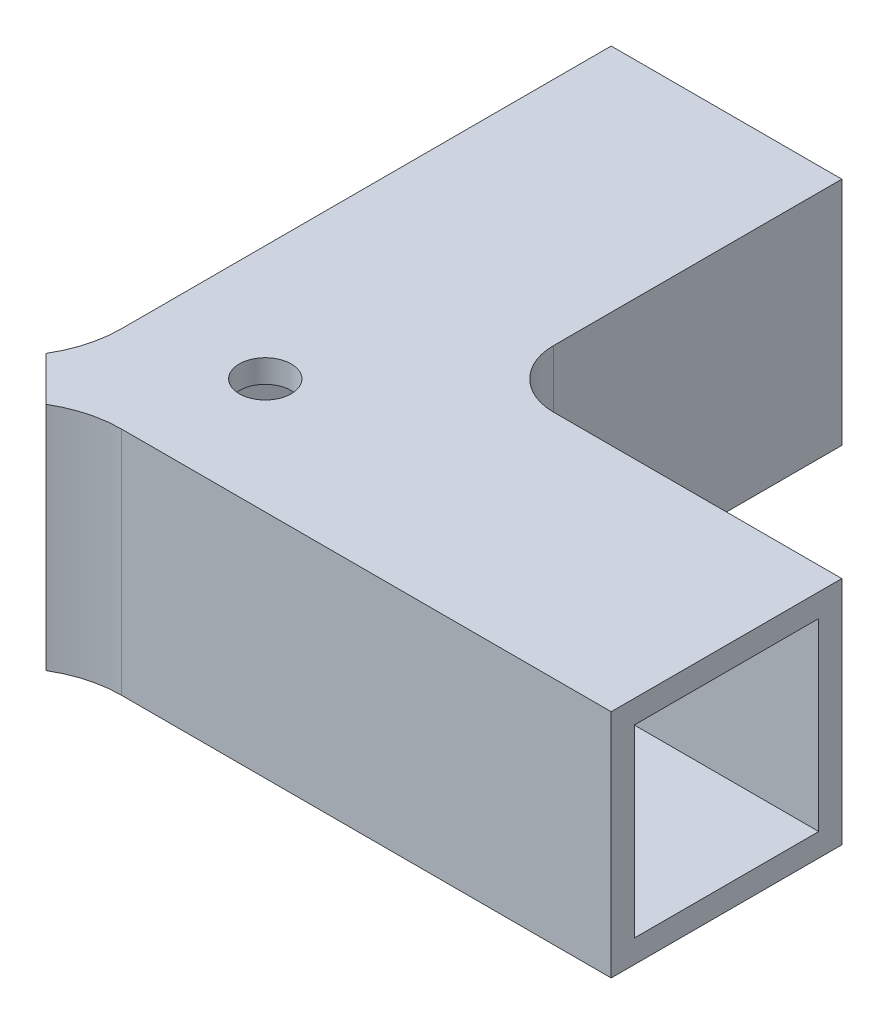
from build123d import *

# Parameters (mm, degrees)
SKETCH1_W                = 20
SKETCH1_H                = 20
SKETCH1_W_2              = 16
SKETCH1_H_2              = 16
BOSS_EXTRUDE1_DEPTH      = 30
BOSS_EXTRUDE2_DEPTH      = 30
BOSS_EXTRUDE2_DEPTH_BACK = 20
SKETCH2_W                = 20
SKETCH2_H                = 20
SKETCH2_W_2              = 16
SKETCH2_H_2              = 16
SKETCH3_W                = 16
SKETCH3_H                = 16
CUT_EXTRUDE1_DEPTH       = 2
SKETCH4_W                = 16
SKETCH4_H                = 16
BOSS_EXTRUDE3_DEPTH      = 2
CHAMFER1_SIZE            = 1
BOSS_EXTRUDE4_REACH      = 83.243
SKETCH5_W                = 2
SKETCH5_H                = 20
BOSS_EXTRUDE6_REACH      = 83.243
SKETCH7_W                = 2
SKETCH7_H                = 20
FILLET1_R                = 10
FILLET2_R                = 3
CUT_EXTRUDE2_REACH       = 76.454
SKETCH8_R                = 2.25
FILLET3_R                = 5


with BuildPart() as part:
    # Sketch1 → Boss-Extrude1 (new body)
    with BuildSketch(Plane.XY):
        with Locations((10, 10)):
            Rectangle(SKETCH1_W, SKETCH1_H)
        with Locations((10, 10)):
            Rectangle(SKETCH1_W_2, SKETCH1_H_2, mode=Mode.SUBTRACT)
    extrude(amount=BOSS_EXTRUDE1_DEPTH)

    # Sketch2 → Boss-Extrude2 (add, two sides: drawn at the far end of the back side and taken through both)
    with BuildSketch(Plane(origin=(20, 0, 0), x_dir=(0, 0, -1), z_dir=(1, 0, 0)).offset(-BOSS_EXTRUDE2_DEPTH_BACK)):
        with Locations((-40, 10)):
            Rectangle(SKETCH2_W, SKETCH2_H)
        with Locations((-40, 10)):
            Rectangle(SKETCH2_W_2, SKETCH2_H_2, mode=Mode.SUBTRACT)
    extrude(amount=BOSS_EXTRUDE2_DEPTH + BOSS_EXTRUDE2_DEPTH_BACK)

    # Sketch3 → Cut-Extrude1 (cut)
    with BuildSketch(Plane(origin=(0, 0, 30), x_dir=(-1, 0, 0), z_dir=(0, 0, -1))):
        with Locations((-10, 10)):
            Rectangle(SKETCH3_W, SKETCH3_H)
    extrude(amount=-CUT_EXTRUDE1_DEPTH, mode=Mode.SUBTRACT)

    # Sketch4 → Boss-Extrude3 (add)
    with BuildSketch(Plane.ZY):
        with Locations((40, 10)):
            Rectangle(SKETCH4_W, SKETCH4_H)
    extrude(amount=-BOSS_EXTRUDE3_DEPTH)

    # Chamfer1
    chamfer1_edges = [part.edges().sort_by_distance(p)[0] for p in [
        (0, 10, 50),
    ]]
    chamfer(chamfer1_edges, length=CHAMFER1_SIZE)

    # Boss-Extrude4: up to this face of the body (flat: up to its plane)
    boss_extrude4_end = Plane(part.part.faces().sort_by_distance((0, 10, 24.5))[0])
    # Sketch5 → Boss-Extrude4 (add, up to the picked face)
    with BuildSketch(Plane(origin=(-24.5, 0, 24.5), x_dir=(0.7071067811865475, 0, 0.7071067811865477), z_dir=(-0.7071067811865477, 0, 0.7071067811865475)), mode=Mode.PRIVATE) as boss_extrude4_sk1:
        with Locations((33.648232278, 10)):
            Rectangle(SKETCH5_W, SKETCH5_H)
    boss_extrude4_tool1 = split(extrude(boss_extrude4_sk1.sketch, amount=-BOSS_EXTRUDE4_REACH, mode=Mode.PRIVATE), bisect_by=boss_extrude4_end, keep=Keep.BOTH, mode=Mode.PRIVATE)
    add(boss_extrude4_tool1.solids().sort_by(Axis((-0.707107, 10, 48.292893), (0.7071067811865477, 0, -0.7071067811865475)))[0])

    # Boss-Extrude6: up to this face of the body (flat: up to its plane)
    boss_extrude6_end = Plane(part.part.faces().sort_by_distance((25.5, 10, 50))[0])
    # Sketch7 → Boss-Extrude6 (add, up to the picked face)
    with BuildSketch(Plane(origin=(-24.5, 0, 24.5), x_dir=(0.7071067811865475, 0, 0.7071067811865477), z_dir=(-0.7071067811865477, 0, 0.7071067811865475)), mode=Mode.PRIVATE) as boss_extrude6_sk1:
        with Locations((37.062445841, 10)):
            Rectangle(SKETCH7_W, SKETCH7_H)
    boss_extrude6_tool1 = split(extrude(boss_extrude6_sk1.sketch, amount=-BOSS_EXTRUDE6_REACH, mode=Mode.PRIVATE), bisect_by=boss_extrude6_end, keep=Keep.BOTH, mode=Mode.PRIVATE)
    add(boss_extrude6_tool1.solids().sort_by(Axis((1.707107, 10, 50.707107), (0.7071067811865477, 0, -0.7071067811865475)))[0])

    # Fillet1
    # the kernel refuses this fillet: 10 mm, written as the material it adds along each edge
    with BuildSketch(Plane(origin=(0, 0, 46.171572875), x_dir=(-0.7071067811878772, 0, 0.7071067811852179), z_dir=(0, 1, 0))) as fillet1_piece_1:
        with BuildLine():
            CenterArc((4.445859456, -9.696276168), FILLET1_R, 104.157365729, 30.842634271)
            Line((-2.625208356, -2.625208356), (-2.766629712, -2.483787))
            Line((-2.766629712, -2.483787), (-0.141421356, 0.141421356))
            Line((-0.141421356, 0.141421356), (0, 0.2))
            ThreePointArc((0, 0.2), (1, 0.2), (1.951082811, 0.193925523))
            Line((1.951082811, 0.193925523), (2, 0))
        make_face()
    extrude(amount=20)
    with BuildSketch(Plane(origin=(3.828427125, 20, 50), x_dir=(1, 0, 0), z_dir=(0, -1, 0))) as fillet1_piece_2:
        with BuildLine():
            CenterArc((3.712605261, 10), FILLET1_R, 239.157365729, 30.842634271)
            Line((-1.414213562, 1.414213562), (-1.516749939, 1.242497834))
            ThreePointArc((-1.516749939, 1.242497834), (-0.848528137, 0.565685425), (-0.141421356, -0.141421356))
            Line((-0.141421356, -0.141421356), (0, -0.2))
            Line((0, -0.2), (3.712605261, -0.2))
            Line((3.712605261, -0.2), (3.712605261, 0))
        make_face()
    extrude(amount=20)

    # Fillet2
    fillet2_edges = [part.edges().sort_by_distance(p)[0] for p in [
        (18, 10, 32),
    ]]
    fillet(fillet2_edges, radius=FILLET2_R)

    # Cut-Extrude2: up to this face of the body (flat: up to its plane)
    cut_extrude2_end = Plane(part.part.faces().sort_by_distance((19.305922938, 0, 30.694077062))[0])
    # Sketch8 → Cut-Extrude2 (cut, up to the picked face)
    with BuildSketch(Plane(origin=(0, 20, 0), x_dir=(1, 0, 0), z_dir=(0, 1, 0)), mode=Mode.PRIVATE) as cut_extrude2_sk1:
        with Locations(Location((10, -40, 0), (0, 0, 270))):
            Circle(SKETCH8_R)
    cut_extrude2_tool1 = split(extrude(cut_extrude2_sk1.sketch, amount=-CUT_EXTRUDE2_REACH, mode=Mode.PRIVATE), bisect_by=cut_extrude2_end, keep=Keep.BOTH, mode=Mode.PRIVATE)
    add(cut_extrude2_tool1.solids().sort_by(Axis((10, 20, 40), (0, -1, 0)))[0], mode=Mode.SUBTRACT)

    # Fillet3
    fillet3_edges = [part.edges().sort_by_distance(p)[0] for p in [
        (20, 10, 30),
    ]]
    fillet(fillet3_edges, radius=FILLET3_R)


solid = part.part
